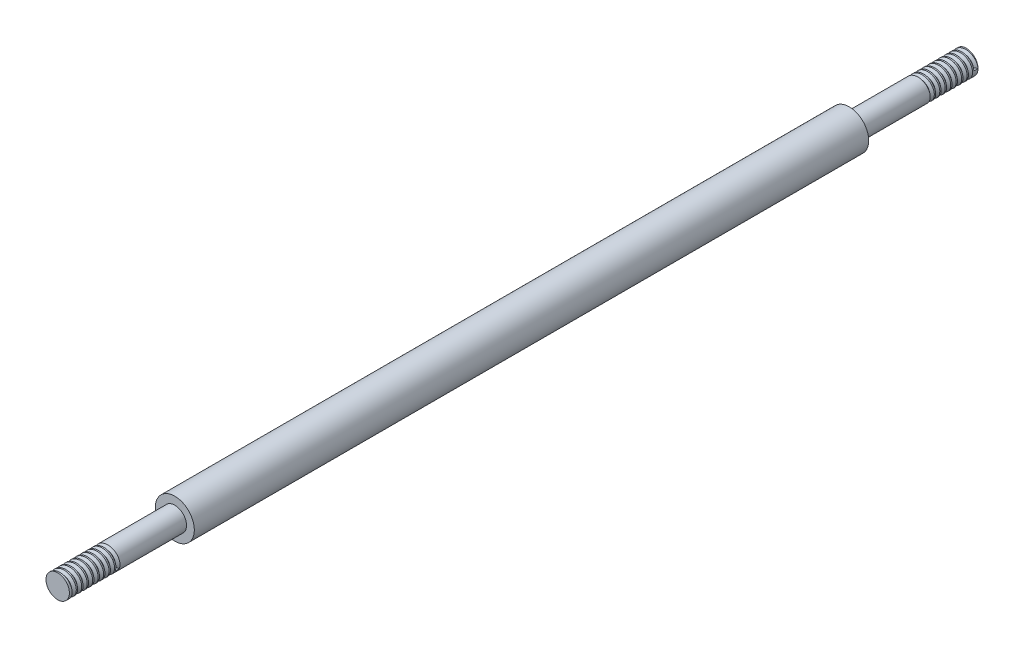
from build123d import *

# Parameters (mm, degrees)
SKETCH1_R           = 1.25
BOSS_EXTRUDE1_DEPTH = 43.2
SKETCH2_R           = 0.75
BOSS_EXTRUDE2_DEPTH = 7.5
THREAD1_PITCH       = 0.35
BOSS_EXTRUDE3_START = 7.5
SKETCH6_R           = 0.75
BOSS_EXTRUDE3_DEPTH = 7.5
THREAD2_PITCH       = 0.35
SCALE1_SCALE        = 0.95
SCALE2_SCALE        = 1.052631579
SCALE3_SCALE        = 0.94


with BuildPart() as part:
    # Sketch1 → Boss-Extrude1 (new body)
    with BuildSketch(Plane.XY):
        with Locations(Location((0, 0, 0), (0, 0, 180))):
            Circle(SKETCH1_R)
    extrude(amount=BOSS_EXTRUDE1_DEPTH)

    # Sketch2 → Boss-Extrude2 (add)
    with BuildSketch(Plane.XY.offset(43.2)):
        Circle(SKETCH2_R)
    extrude(amount=BOSS_EXTRUDE2_DEPTH)

    # Thread1: the profile of Thread Profile1 profile screwed along a right-hand helix of 8.571429 turns, 6 arcs to a turn; built about Z, then put on its axis
    thread1_z = Axis((0, 0, 0), (0, 0, 1))
    thread1_corners = [(0.7503, 0, 0.262673206), (0.560556942, 0, 0.153125001), (0.560556942, 0, 0.109375001), (0.7503, 0, -0.000173205)]
    with BuildLine(mode=Mode.PRIVATE) as thread1_profile:
        Line(thread1_corners[0], thread1_corners[1])
        Line(thread1_corners[1], thread1_corners[2])
        Line(thread1_corners[2], thread1_corners[3])
        Line(thread1_corners[3], thread1_corners[0])
    thread1_cap = Face(thread1_profile.wire())
    thread1_turn_angles = [0, 30, 60, 90, 120, 150, 180, 210, 240, 270, 300, 330, 360]
    thread1_turn_weights = [1, 0.8660254037844387, 1, 0.8660254037844387, 1, 0.8660254037844387, 1, 0.8660254037844387, 1, 0.8660254037844387, 1, 0.8660254037844387, 1]
    thread1_turn_rails = [Edge.make_bspline([Vector(p[0], p[1], 0).rotate(thread1_z, thread1_turn_angles[k]) / thread1_turn_weights[k] + Vector(0, 0, p[2] + THREAD1_PITCH * thread1_turn_angles[k] / 360) for k in range(13)], [0, 0, 0, 1, 1, 2, 2, 3, 3, 4, 4, 5, 5, 6, 6, 6], 2, thread1_turn_weights) for p in thread1_corners]
    thread1_turn_sides = [Face.make_surface_from_curves(thread1_turn_rails[p[0]], thread1_turn_rails[p[1]]) for p in [(0, 1), (1, 2), (2, 3), (3, 0)]]
    thread1_last_angles = [2880, 2910, 2940, 2970, 3000, 3030, 3060, 3072.857142857, 3085.714285714]
    thread1_last_weights = [1, 0.8660254037844387, 1, 0.8660254037844387, 1, 0.8660254037844387, 1, 0.9749279121818235, 1]
    thread1_last_rails = [Edge.make_bspline([Vector(p[0], p[1], 0).rotate(thread1_z, thread1_last_angles[k]) / thread1_last_weights[k] + Vector(0, 0, p[2] + THREAD1_PITCH * thread1_last_angles[k] / 360) for k in range(9)], [0, 0, 0, 1, 1, 2, 2, 3, 3, 4, 4, 4], 2, thread1_last_weights) for p in thread1_corners]
    thread1_last_sides = [Face.make_surface_from_curves(thread1_last_rails[p[0]], thread1_last_rails[p[1]]) for p in [(0, 1), (1, 2), (2, 3), (3, 0)]]
    thread1 = Plane(origin=(0, 0, 50.7), x_dir=(-1, 0, 0), z_dir=(0, 0, -1)) * Solid(Shell([*[p.moved(Location((0, 0, THREAD1_PITCH * i))) for i in range(8) for p in thread1_turn_sides], *thread1_last_sides, thread1_cap, thread1_cap.rotate(thread1_z, 3085.714285714).moved(Location((0, 0, THREAD1_PITCH * 3085.714285714 / 360)))]))
    add(thread1, mode=Mode.SUBTRACT)

    # Sketch6 → Boss-Extrude3 (add)
    with BuildSketch(Plane(origin=(0, 0, 0), x_dir=(-1, 0, 0), z_dir=(0, 0, -1)).offset(BOSS_EXTRUDE3_START)):
        Circle(SKETCH6_R)
    extrude(amount=-BOSS_EXTRUDE3_DEPTH)

    # Thread2: the profile of Thread Profile2 profile screwed along a right-hand helix of 8.571429 turns, 6 arcs to a turn; built about Z, then put on its axis
    thread2_z = Axis((0, 0, 0), (0, 0, 1))
    thread2_corners = [(0.7503, 0, 0.262673206), (0.560556942, 0, 0.153125001), (0.560556942, 0, 0.109375001), (0.7503, 0, -0.000173205)]
    with BuildLine(mode=Mode.PRIVATE) as thread2_profile:
        Line(thread2_corners[0], thread2_corners[1])
        Line(thread2_corners[1], thread2_corners[2])
        Line(thread2_corners[2], thread2_corners[3])
        Line(thread2_corners[3], thread2_corners[0])
    thread2_cap = Face(thread2_profile.wire())
    thread2_turn_angles = [0, 30, 60, 90, 120, 150, 180, 210, 240, 270, 300, 330, 360]
    thread2_turn_weights = [1, 0.8660254037844387, 1, 0.8660254037844387, 1, 0.8660254037844387, 1, 0.8660254037844387, 1, 0.8660254037844387, 1, 0.8660254037844387, 1]
    thread2_turn_rails = [Edge.make_bspline([Vector(p[0], p[1], 0).rotate(thread2_z, thread2_turn_angles[k]) / thread2_turn_weights[k] + Vector(0, 0, p[2] + THREAD2_PITCH * thread2_turn_angles[k] / 360) for k in range(13)], [0, 0, 0, 1, 1, 2, 2, 3, 3, 4, 4, 5, 5, 6, 6, 6], 2, thread2_turn_weights) for p in thread2_corners]
    thread2_turn_sides = [Face.make_surface_from_curves(thread2_turn_rails[p[0]], thread2_turn_rails[p[1]]) for p in [(0, 1), (1, 2), (2, 3), (3, 0)]]
    thread2_last_angles = [2880, 2910, 2940, 2970, 3000, 3030, 3060, 3072.857142857, 3085.714285714]
    thread2_last_weights = [1, 0.8660254037844387, 1, 0.8660254037844387, 1, 0.8660254037844387, 1, 0.9749279121818235, 1]
    thread2_last_rails = [Edge.make_bspline([Vector(p[0], p[1], 0).rotate(thread2_z, thread2_last_angles[k]) / thread2_last_weights[k] + Vector(0, 0, p[2] + THREAD2_PITCH * thread2_last_angles[k] / 360) for k in range(9)], [0, 0, 0, 1, 1, 2, 2, 3, 3, 4, 4, 4], 2, thread2_last_weights) for p in thread2_corners]
    thread2_last_sides = [Face.make_surface_from_curves(thread2_last_rails[p[0]], thread2_last_rails[p[1]]) for p in [(0, 1), (1, 2), (2, 3), (3, 0)]]
    thread2 = Plane(origin=(0, 0, -7.5), x_dir=(1, 0, 0), z_dir=(0, 0, 1)) * Solid(Shell([*[p.moved(Location((0, 0, THREAD2_PITCH * i))) for i in range(8) for p in thread2_turn_sides], *thread2_last_sides, thread2_cap, thread2_cap.rotate(thread2_z, 3085.714285714).moved(Location((0, 0, THREAD2_PITCH * 3085.714285714 / 360)))]))
    add(thread2, mode=Mode.SUBTRACT)


with BuildPart() as part_1:
    # Scale1: scaled about (-2.42e-07, -0.000214789, 21.600012017)
    add(part.part.scale(SCALE1_SCALE).moved(Location((-1.2e-08, -1.0739e-05, 1.080000601))))


with BuildPart() as part_2:
    # Scale2: scaled about (-2.42e-07, -0.000214789, 21.600012017)
    add(part_1.part.scale(SCALE2_SCALE).moved(Location((1.3e-08, 1.1305e-05, -1.136842738))))


with BuildPart() as part_3:
    # Scale3: scaled about (-2.42e-07, -0.000214789, 21.600012017)
    add(part_2.part.scale(SCALE3_SCALE).moved(Location((-1.5e-08, -1.2887e-05, 1.296000721))))


solid = part_3.part
